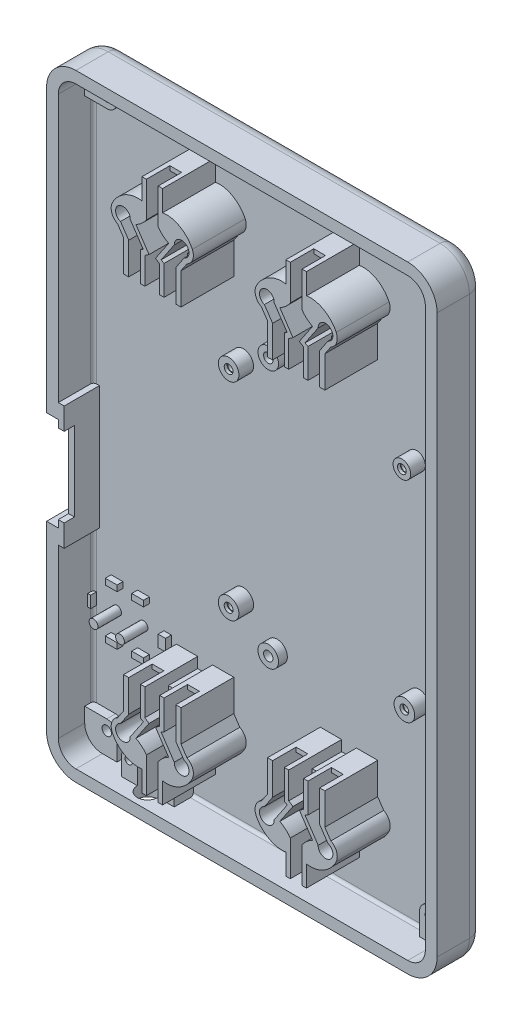
from build123d import *

# Parameters (mm, degrees)
SALIENTE_EXTRUIR1_DEPTH      = 16
REDONDEO1_R                  = 4.999999999999999
VACIADO1_T                   = -4
CORTAR_EXTRUIR5_DEPTH        = 153.71391475445148
CORTAR_EXTRUIR5_DEPTH_BACK   = 157.71391475445148
CORTAR_EXTRUIR5_START        = 4
CROQUIS4_R                   = 1.600000000000006
CORTAR_EXTRUIR6_START        = 3
CROQUIS4_19_R                = 3.5000000000000075
CROQUIS4_19_R_2              = 1.600000000000006
CORTAR_EXTRUIR6_DEPTH        = 3
SALIENTE_EXTRUIR14_START     = 7
CROQUIS4_21_R                = 3.5000000000000075
CROQUIS4_21_R_2              = 1.600000000000006
SALIENTE_EXTRUIR14_DEPTH     = 3
SALIENTE_EXTRUIR23_START     = 4
CROQUIS4_27_R                = 3.500000000000001
CROQUIS4_27_R_2              = 1.600000000000006
SALIENTE_EXTRUIR23_DEPTH     = 3
CROQUIS4_25_R                = 3.500000000000001
CROQUIS4_25_R_2              = 1.600000000000006
CORTAR_EXTRUIR23_DEPTH       = 3
CROQUIS4_24_R                = 1.600000000000006
CORTAR_EXTRUIR22_DEPTH       = 4
GUIA_START                   = 4
GUIA_CONTACTOS_DEPTH         = 18
ELEVADORES_START             = 4
CROQUIS5_23_W                = 3.999999999999968
CROQUIS5_23_H                = 1.495870233391173
CROQUIS5_23_W_2              = 3.999999999999927
CROQUIS5_23_H_2              = 1.5023941548379014
CROQUIS5_23_W_3              = 4.0000000000000036
CROQUIS5_23_H_3              = 1.50239415483788
CROQUIS5_23_H_4              = 1.5048196161779401
CROQUIS5_23_W_4              = 3.99999999999997
CROQUIS5_23_H_5              = 1.4958702333911873
CROQUIS5_23_W_5              = 4
CROQUIS5_23_H_6              = 1.5023941548378872
CROQUIS5_23_H_7              = 1.5023941548379156
CROQUIS5_23_W_6              = 3.999999999999993
CROQUIS5_23_W_7              = 4.000000000000014
CROQUIS5_23_W_8              = 3.9999999999999147
CROQUIS5_23_W_9              = 3.999999999999929
CROQUIS5_23_W_10             = 3.9999999999999716
ELEVADORES_DEPTH             = 10
SALIENTE_EXTRUIR16_START     = 4
CROQUIS5_28_R                = 1.4999999999999973
SALIENTE_EXTRUIR16_DEPTH     = 8.000000000000002
SALIENTE_EXTRUIR17_START     = 4
CROQUIS5_30_W                = 2.500000000000014
CROQUIS5_30_H                = 4.000000000000014
CROQUIS5_30_W_2              = 0.9999999999999716
CROQUIS5_30_H_2              = 4
CROQUIS5_30_W_3              = 3.999999999999986
CROQUIS5_30_H_3              = 2.0000000000000213
CROQUIS5_30_W_4              = 4
CROQUIS5_30_H_4              = 2.0000000000000284
SALIENTE_EXTRUIR17_DEPTH     = 2
CORTAR_EXTRUIR8_START        = 16
CROQUIS5_32_W                = 2.05583072877144
CROQUIS5_32_H                = 4.003270796249199
CORTAR_EXTRUIR8_DEPTH        = 9.2
SALIENTE_EXTRUIR19_START     = 4
SALIENTE_EXTRUIR19_DEPTH     = 12
SALIENTE_EXTRUIR20_START     = 4
CROQUIS5_34_W                = 2.0008606155560784
CROQUIS5_34_H                = 25.496729203750796
CROQUIS5_34_H_2              = 1.503270796249197
SALIENTE_EXTRUIR20_DEPTH     = 8.5
CORTAR_EXTRUIR7_START        = 4
CROQUIS5_26_R                = 1.2499999999999978
CORTAR_EXTRUIR7_DEPTH        = 1.5
SALIENTE_EXTRUIR15_START     = 4
SALIENTE_EXTRUIR15_OUTLINE_R = 1.25
SALIENTE_EXTRUIR15_DEPTH     = 6.5
CORTAR_EXTRUIR9_START        = -113.076923
CORTAR_EXTRUIR9_DEPTH        = 12.5
SALIENTE_EXTRUIR25_START     = 4
CROQUIS5_42_R                = 1.5000000000000009
CROQUIS5_42_R_2              = 3.500000000000001
CROQUIS5_42_R_3              = 1.5000000000000042
CROQUIS5_42_R_4              = 3.0000000000000004
CROQUIS5_42_R_5              = 1.4999999999999991
CROQUIS5_42_R_6              = 1.2499999999999978
CROQUIS5_42_R_7              = 1.2500000000000013
SALIENTE_EXTRUIR25_DEPTH     = 5
CORTAR_EXTRUIR24_START       = 8
CROQUIS5_44_R                = 1.5000000000000042
CROQUIS5_44_R_2              = 1.2499999999999978
CROQUIS5_44_R_3              = 1.5000000000000009
CROQUIS5_44_R_4              = 1.2500000000000013
CROQUIS5_44_R_5              = 1.4999999999999991
CORTAR_EXTRUIR24_DEPTH       = 1


# Read off the part's stored shape, not the designer's step: Saliente-Extruir15
with BuildPart() as part:
    # Croquis1 → Saliente-Extruir1 (new body)
    with BuildSketch(Plane.XY):
        with BuildLine():
            Line((-97.31663685152034, 96.9230769230769), (15.683363148479588, 96.92307692307689))
            ThreePointArc((15.683363148479588, 96.92307692307689), (22.75443096034506, 93.99414473494237), (25.683363148479593, 86.92307692307689))
            Line((25.683363148479593, 86.92307692307689), (25.68336314847961, -103.07692307692308))
            ThreePointArc((25.68336314847961, -103.07692307692308), (22.754430960345097, -110.14799088878856), (15.683363148479623, -113.07692307692308))
            Line((15.683363148479623, -113.07692307692308), (-97.31663685152034, -113.07692307692308))
            ThreePointArc((-97.31663685152034, -113.07692307692308), (-104.38770466338589, -110.14799088878856), (-107.31663685152041, -103.07692307692301))
            Line((-107.31663685152041, -103.07692307692301), (-107.31663685152041, 86.92307692307682))
            ThreePointArc((-107.31663685152041, 86.92307692307682), (-104.3877046633859, 93.99414473494238), (-97.31663685152034, 96.9230769230769))
        make_face()
    extrude(amount=SALIENTE_EXTRUIR1_DEPTH)

    # Redondeo1
    redondeo1_edges = [part.edges().sort_by_distance(p)[0] for p in [
        (-107.31663685152041, -8.076923076923094, 0),
        (-104.3877046633859, 93.99414473494238, 0),
        (-40.81663685152038, 96.9230769230769, 0),
        (22.75443096034506, 93.99414473494237, 0),
        (25.6833631484796, -8.076923076923094, 0),
        (22.754430960345097, -110.14799088878856, 0),
        (-40.816636851520364, -113.07692307692308, 0),
        (-104.38770466338589, -110.14799088878856, 0),
    ]]
    fillet(redondeo1_edges, radius=REDONDEO1_R)

    # Vaciado1
    vaciado1_openings = [part.faces().sort_by_distance(p)[0] for p in [
        (-40.816636852, -8.076923077, 16),
    ]]
    offset(amount=VACIADO1_T, openings=vaciado1_openings, kind=Kind.INTERSECTION)

    # Croquis4 → Cortar-Extruir5 (cut, two sides: drawn at the far end of the back side and taken through both)
    with BuildSketch(Plane.XY.offset(CORTAR_EXTRUIR5_START - CORTAR_EXTRUIR5_DEPTH_BACK)):
        with Locations(Location((-95.81663685152039, 85.4230769230769, 0), (0, 0, 180))):
            Circle(CROQUIS4_R)
        with Locations(Location((14.18336314847958, 85.4230769230769, 0), (0, 0, 180))):
            Circle(CROQUIS4_R)
        with Locations(Location((-95.81663685152039, -101.5769230769231, 0), (0, 0, 180))):
            Circle(CROQUIS4_R)
        with Locations(Location((14.18336314847958, -101.5769230769231, 0), (0, 0, 180))):
            Circle(CROQUIS4_R)
    extrude(amount=CORTAR_EXTRUIR5_DEPTH + CORTAR_EXTRUIR5_DEPTH_BACK, mode=Mode.SUBTRACT)

    # Croquis4<19> → Cortar-Extruir6 (cut)
    # profile 1 of 4: a face of its own
    with BuildSketch(Plane.XY.offset(CORTAR_EXTRUIR6_START)):
        with Locations(Location((-95.81663685152039, 85.4230769230769, 0), (0, 0, 180))):
            Circle(CROQUIS4_19_R)
        with Locations(Location((-95.81663685152039, 85.4230769230769, 0), (0, 0, 180))):
            Circle(CROQUIS4_19_R_2, mode=Mode.SUBTRACT)
    # profile 2 of 4: a face of its own
    with BuildSketch(Plane.XY.offset(CORTAR_EXTRUIR6_START)):
        with Locations(Location((14.18336314847958, 85.4230769230769, 0), (0, 0, 180))):
            Circle(CROQUIS4_19_R)
        with Locations(Location((14.18336314847958, 85.4230769230769, 0), (0, 0, 180))):
            Circle(CROQUIS4_19_R_2, mode=Mode.SUBTRACT)
    # profile 3 of 4: a face of its own
    with BuildSketch(Plane.XY.offset(CORTAR_EXTRUIR6_START)):
        with Locations(Location((-95.81663685152039, -101.5769230769231, 0), (0, 0, 180))):
            Circle(CROQUIS4_19_R)
        with Locations(Location((-95.81663685152039, -101.5769230769231, 0), (0, 0, 180))):
            Circle(CROQUIS4_19_R_2, mode=Mode.SUBTRACT)
    # profile 4 of 4: a face of its own
    with BuildSketch(Plane.XY.offset(CORTAR_EXTRUIR6_START)):
        with Locations(Location((14.18336314847958, -101.5769230769231, 0), (0, 0, 180))):
            Circle(CROQUIS4_19_R)
        with Locations(Location((14.18336314847958, -101.5769230769231, 0), (0, 0, 180))):
            Circle(CROQUIS4_19_R_2, mode=Mode.SUBTRACT)
    extrude(amount=-CORTAR_EXTRUIR6_DEPTH, mode=Mode.SUBTRACT)

    # Croquis4<21> → Saliente-Extruir14 (add)
    # profile 1 of 8: a face of its own
    with BuildSketch(Plane.XY.offset(SALIENTE_EXTRUIR14_START)):
        with BuildLine():
            Line((-92.31663685152039, -109.07692307692308), (-92.31663685152039, -101.5769230769231))
            ThreePointArc((-92.31663685152037, -101.5769230769231), (-98.29151058567331, -104.05179681107602), (-95.81663685152039, -98.07692307692308))
            Line((-95.81663685152039, -98.0769230769231), (-103.31663685152041, -98.0769230769231))
            ThreePointArc((-103.31663685152041, -98.0769230769231), (-101.66898680688021, -107.42927303228294), (-92.31663685152039, -109.0769230769231))
        make_face()
    # profile 2 of 8: a face of its own
    with BuildSketch(Plane.XY.offset(SALIENTE_EXTRUIR14_START)):
        with Locations(Location((-95.81663685152039, -101.5769230769231, 0), (0, 0, 180))):
            Circle(CROQUIS4_21_R)
        with Locations(Location((-95.81663685152039, -101.5769230769231, 0), (0, 0, 180))):
            Circle(CROQUIS4_21_R_2, mode=Mode.SUBTRACT)
    # profile 3 of 8: a face of its own
    with BuildSketch(Plane.XY.offset(SALIENTE_EXTRUIR14_START)):
        with Locations(Location((14.18336314847958, -101.5769230769231, 0), (0, 0, 180))):
            Circle(CROQUIS4_21_R)
        with Locations(Location((14.18336314847958, -101.5769230769231, 0), (0, 0, 180))):
            Circle(CROQUIS4_21_R_2, mode=Mode.SUBTRACT)
    # profile 4 of 8: a face of its own
    with BuildSketch(Plane.XY.offset(SALIENTE_EXTRUIR14_START)):
        with BuildLine():
            ThreePointArc((17.68336314847959, -101.5769230769231), (14.18336314847958, -105.07692307692311), (10.683363148479573, -101.5769230769231))
            Line((10.683363148479577, -101.5769230769231), (10.683363148479577, -109.0769230769231))
            ThreePointArc((10.683363148479579, -109.0769230769231), (20.03571310383939, -107.42927303228291), (21.683363148479582, -98.0769230769231))
            Line((21.683363148479586, -98.0769230769231), (14.18336314847958, -98.0769230769231))
            ThreePointArc((14.18336314847958, -98.07692307692308), (16.6582368826325, -99.10204934277017), (17.68336314847959, -101.5769230769231))
        make_face()
    # profile 5 of 8: a face of its own
    with BuildSketch(Plane.XY.offset(SALIENTE_EXTRUIR14_START)):
        with BuildLine():
            ThreePointArc((17.68336314847959, 85.4230769230769), (16.6582368826325, 82.94820318892398), (14.18336314847958, 81.92307692307689))
            Line((14.18336314847958, 81.9230769230769), (21.68336314847957, 81.9230769230769))
            ThreePointArc((21.68336314847958, 81.9230769230769), (20.03571310383939, 91.27542687843672), (10.683363148479579, 92.9230769230769))
            Line((10.683363148479577, 92.9230769230769), (10.683363148479577, 85.4230769230769))
            ThreePointArc((10.683363148479573, 85.4230769230769), (14.18336314847958, 88.92307692307692), (17.68336314847959, 85.4230769230769))
        make_face()
    # profile 6 of 8: a face of its own
    with BuildSketch(Plane.XY.offset(SALIENTE_EXTRUIR14_START)):
        with BuildLine():
            Line((-103.31663685152041, 81.9230769230769), (-95.81663685152039, 81.9230769230769))
            ThreePointArc((-95.81663685152039, 81.92307692307689), (-98.29151058567331, 87.89795065722983), (-92.31663685152037, 85.4230769230769))
            Line((-92.31663685152039, 85.4230769230769), (-92.31663685152039, 92.9230769230769))
            ThreePointArc((-92.31663685152039, 92.9230769230769), (-101.66898680688021, 91.27542687843673), (-103.31663685152041, 81.9230769230769))
        make_face()
    # profile 7 of 8: a face of its own
    with BuildSketch(Plane.XY.offset(SALIENTE_EXTRUIR14_START)):
        with Locations(Location((-95.81663685152039, 85.4230769230769, 0), (0, 0, 180))):
            Circle(CROQUIS4_21_R)
        with Locations(Location((-95.81663685152039, 85.4230769230769, 0), (0, 0, 180))):
            Circle(CROQUIS4_21_R_2, mode=Mode.SUBTRACT)
    # profile 8 of 8: a face of its own
    with BuildSketch(Plane.XY.offset(SALIENTE_EXTRUIR14_START)):
        with Locations(Location((14.18336314847958, 85.4230769230769, 0), (0, 0, 180))):
            Circle(CROQUIS4_21_R)
        with Locations(Location((14.18336314847958, 85.4230769230769, 0), (0, 0, 180))):
            Circle(CROQUIS4_21_R_2, mode=Mode.SUBTRACT)
    extrude(amount=-SALIENTE_EXTRUIR14_DEPTH)

    # Croquis4<27> → Saliente-Extruir23 (add)
    # profile 1 of 2: a face of its own
    with BuildSketch(Plane.XY.offset(SALIENTE_EXTRUIR23_START)):
        with Locations(Location((-40.81663685, -52.05517796000001, 0), (0, 0, 180))):
            Circle(CROQUIS4_27_R)
        with Locations(Location((-40.81663685, -52.05517796000001, 0), (0, 0, 180))):
            Circle(CROQUIS4_27_R_2, mode=Mode.SUBTRACT)
    # profile 2 of 2: a face of its own
    with BuildSketch(Plane.XY.offset(SALIENTE_EXTRUIR23_START)):
        with Locations(Location((-40.81663685, 35.90133180615383, 0), (0, 0, 180))):
            Circle(CROQUIS4_27_R)
        with Locations(Location((-40.81663685, 35.90133180615383, 0), (0, 0, 180))):
            Circle(CROQUIS4_27_R_2, mode=Mode.SUBTRACT)
    extrude(amount=SALIENTE_EXTRUIR23_DEPTH)

    # Croquis4<25> → Cortar-Extruir23 (cut)
    # profile 1 of 2: a face of its own
    with BuildSketch(Plane.XY):
        with Locations(Location((-40.81663685, 35.90133180615383, 0), (0, 0, 180))):
            Circle(CROQUIS4_25_R)
        with Locations(Location((-40.81663685, 35.90133180615383, 0), (0, 0, 180))):
            Circle(CROQUIS4_25_R_2, mode=Mode.SUBTRACT)
    # profile 2 of 2: a face of its own
    with BuildSketch(Plane.XY):
        with Locations(Location((-40.81663685, -52.05517796000001, 0), (0, 0, 180))):
            Circle(CROQUIS4_25_R)
    extrude(amount=CORTAR_EXTRUIR23_DEPTH, mode=Mode.SUBTRACT)

    # Croquis4<24> → Cortar-Extruir22 (cut)
    with BuildSketch(Plane.XY):
        with Locations(Location((-40.81663685, 35.90133180615383, 0), (0, 0, 180))):
            Circle(CROQUIS4_24_R)
        with Locations(Location((-40.81663685, 35.90133180615383, 0), (0, 0, 180))):
            Circle(CROQUIS4_24_R)
        with Locations(Location((-40.81663685, -52.05517796000001, 0), (0, 0, 180))):
            Circle(CROQUIS4_24_R)
        with Locations(Location((-40.81663685, -52.05517796000001, 0), (0, 0, 180))):
            Circle(CROQUIS4_24_R)
    extrude(amount=CORTAR_EXTRUIR22_DEPTH, mode=Mode.SUBTRACT)

    # Croquis5 → Guia contactos (add)
    with BuildSketch(Plane.XY.offset(GUIA_START)):
        with BuildLine():
            add(Edge.make_bspline(
                [(-14.31446443693543, 70.83330117078295), (-12.937333148817942, 68.81948124165703), (-10.732177002347047, 67.71401682524635)],
                knots=[0, 0, 0, 1, 1, 1], degree=2))
            Line((-10.732177002347047, 67.71401682524635), (-15.214799061629035, 61.06825632356019))
            Line((-15.214799061629035, 61.06825632356019), (-13.791142664068888, 60.10798795834564))
            Line((-13.791142664068888, 60.10798795834564), (-13.791142664068888, 51.01265147656485))
            Line((-13.791142664068888, 51.01265147656485), (-12.29114266406886, 51.01265147656485))
            Line((-12.29114266406886, 51.01265147656485), (-12.29114266406886, 61.012970877053235))
            Line((-12.29114266406886, 61.012970877053235), (-13.284871664701193, 61.57583078020071))
            Line((-13.284871664701193, 61.57583078020071), (-8.811328436935405, 68.20813136064118))
            ThreePointArc((-8.811328436935408, 68.20813136064118), (-4.916482478448227, 70.40589465712105), (-5.495178146715252, 65.97135974675818))
            Line((-5.4951781467152525, 65.97135974675818), (-8.29114266406894, 61.82617188398296))
            Line((-8.29114266406894, 61.82617188398296), (-8.29114266406893, 51.01265147656484))
            Line((-8.291142664068932, 51.01265147656485), (-6.540915292091843, 51.01265147656486))
            Line((-6.540915292091843, 51.01265147656486), (-6.540915292091857, 61.73855319674161))
            Line((-6.540915292091857, 61.73855319674161), (-4.495705334222554, 64.77070165269237))
            ThreePointArc((-4.495705334222555, 64.77070165269237), (-2.5392227122782574, 67.01135188264527), (-2.670528445962964, 69.98306797057487))
            add(Edge.make_bspline(
                [(-12.814464436935427, 75.67812155367763), (-8.642487954529075, 76.44626330917993), (-4.4067063051095925, 73.67631329568229), (-2.670528445962965, 69.98306797057487)],
                knots=[0, 0, 0, 0, 1, 1, 1, 1], degree=3))
            Line((-12.814464436935427, 75.67812155367763), (-12.814464436935427, 82.8335023695889))
            Line((-12.814464436935427, 82.8335023695889), (-14.31446443693543, 82.8335023695889))
            Line((-14.31446443693543, 82.8335023695889), (-14.31446443693543, 70.83330117078295))
        make_face()
        with BuildLine():
            Line((-17.414129812241907, 61.06825632356015), (-21.896751871523783, 67.71401682524635))
            add(Edge.make_bspline(
                [(-18.3144644369354, 70.83330117078295), (-19.691595725052892, 68.81948124165703), (-21.896751871523783, 67.71401682524635)],
                knots=[0, 0, 0, 1, 1, 1], degree=2))
            Line((-18.3144644369354, 70.83330117078295), (-18.3144644369354, 82.8335023695889))
            Line((-18.3144644369354, 82.8335023695889), (-19.814464436935403, 82.8335023695889))
            Line((-19.814464436935403, 82.8335023695889), (-19.814464436935403, 75.67812155367763))
            add(Edge.make_bspline(
                [(-19.814464436935403, 75.67812155367763), (-23.986440919341387, 76.44626330917968), (-28.22222256876174, 73.67631329568262), (-29.958400427907865, 69.98306797057487)],
                knots=[0, 0, 0, 0, 1, 1, 1, 1], degree=3))
            ThreePointArc((-29.958400427907865, 69.98306797057487), (-30.089706161592574, 67.01135188264529), (-28.133223539648306, 64.77070165269237))
            Line((-28.133223539648306, 64.77070165269237), (-26.088013581778974, 61.73855319674161))
            Line((-26.088013581778974, 61.73855319674161), (-26.088013581778974, 51.01265147656485))
            Line((-26.088013581778974, 51.01265147656485), (-24.337786209801976, 51.01265147656485))
            Line((-24.337786209801976, 51.01265147656485), (-24.337786209801976, 61.82617188398289))
            Line((-24.337786209801976, 61.82617188398289), (-27.133750727155558, 65.9713597467582))
            ThreePointArc((-27.133750727155558, 65.9713597467582), (-27.712446395422596, 70.40589465712107), (-23.817600436935415, 68.20813136064118))
            Line((-23.817600436935415, 68.20813136064118), (-19.344057209169673, 61.57583078020068))
            Line((-19.344057209169673, 61.57583078020068), (-20.337786209801973, 61.01297087705325))
            Line((-20.337786209801973, 61.01297087705325), (-20.337786209801973, 51.01265147656485))
            Line((-20.337786209801973, 51.01265147656485), (-18.83778620980197, 51.01265147656485))
            Line((-18.83778620980197, 51.01265147656485), (-18.837786209802054, 60.10798795834862))
            Line((-18.837786209802054, 60.10798795834862), (-17.414129812241907, 61.06825632356015))
        make_face()
        with BuildLine():
            Line((-21.89675187152377, -83.86786297909254), (-17.414129812241892, -77.22210247740634))
            Line((-17.414129812241892, -77.22210247740634), (-18.83778620980204, -76.2618341121948))
            Line((-18.83778620980204, -76.2618341121948), (-18.837786209801955, -67.16649763041104))
            Line((-18.837786209801955, -67.16649763041104), (-20.33778620980196, -67.16649763041104))
            Line((-20.33778620980196, -67.16649763041104), (-20.33778620980196, -77.16681703089944))
            Line((-20.33778620980196, -77.16681703089944), (-19.34405720916966, -77.72967693404686))
            Line((-19.34405720916966, -77.72967693404686), (-23.817600436935408, -84.36197751448736))
            ThreePointArc((-23.817600436935408, -84.36197751448736), (-27.712446395422603, -86.55974081096724), (-27.13375072715555, -82.12520590060436))
            Line((-27.13375072715555, -82.12520590060436), (-24.337786209801962, -77.98001803782907))
            Line((-24.337786209801962, -77.98001803782907), (-24.337786209801962, -67.16649763041104))
            Line((-24.337786209801962, -67.16649763041104), (-26.08801358177896, -67.16649763041104))
            Line((-26.08801358177896, -67.16649763041104), (-26.08801358177896, -77.8923993505878))
            Line((-26.08801358177896, -77.8923993505878), (-28.13322353964829, -80.92454780653856))
            ThreePointArc((-28.13322353964829, -80.92454780653856), (-30.08970616159256, -83.16519803649147), (-29.95840042790785, -86.13691412442105))
            add(Edge.make_bspline(
                [(-19.81446443693539, -91.83196770752382), (-23.986440919341433, -92.60010946302592), (-28.22222256876164, -89.83015944952878), (-29.95840042790785, -86.13691412442105)],
                knots=[0, 0, 0, 0, 1, 1, 1, 1], degree=3))
            Line((-19.81446443693539, -91.83196770752382), (-19.81446443693539, -98.98734852343509))
            Line((-19.81446443693539, -98.98734852343509), (-18.314464436935385, -98.98734852343509))
            Line((-18.314464436935385, -98.98734852343509), (-18.314464436935385, -86.98714732462913))
            add(Edge.make_bspline(
                [(-18.314464436935385, -86.98714732462913), (-19.691595725052878, -84.97332739550322), (-21.89675187152377, -83.86786297909254)],
                knots=[0, 0, 0, 1, 1, 1], degree=2))
        make_face()
        with BuildLine():
            Line((-15.214799061629021, -77.22210247740638), (-10.732177002347033, -83.86786297909254))
            add(Edge.make_bspline(
                [(-14.314464436935415, -86.98714732462913), (-12.937333148817928, -84.97332739550322), (-10.732177002347033, -83.86786297909254)],
                knots=[0, 0, 0, 1, 1, 1], degree=2))
            Line((-14.314464436935415, -86.98714732462913), (-14.314464436935415, -98.98734852343509))
            Line((-14.314464436935415, -98.98734852343509), (-12.814464436935415, -98.98734852343509))
            Line((-12.814464436935415, -98.98734852343509), (-12.814464436935415, -91.83196770752382))
            add(Edge.make_bspline(
                [(-12.814464436935415, -91.83196770752382), (-8.642487954529063, -92.60010946302613), (-4.406706305109576, -89.83015944952848), (-2.6705284459629506, -86.13691412442105)],
                knots=[0, 0, 0, 0, 1, 1, 1, 1], degree=3))
            ThreePointArc((-2.6705284459629506, -86.13691412442105), (-2.539222712278244, -83.16519803649146), (-4.49570533422254, -80.92454780653856))
            Line((-4.4957053342225395, -80.92454780653856), (-6.540915292091843, -77.8923993505878))
            Line((-6.540915292091843, -77.8923993505878), (-6.54091529209183, -67.16649763041104))
            Line((-6.54091529209183, -67.16649763041104), (-8.291142664068918, -67.16649763041104))
            Line((-8.291142664068916, -67.16649763041106), (-8.291142664068925, -77.98001803782914))
            Line((-8.291142664068925, -77.98001803782914), (-5.495178146715238, -82.12520590060436))
            ThreePointArc((-5.4951781467152365, -82.12520590060436), (-4.9164824784481915, -86.55974081096723), (-8.811328436935389, -84.36197751448736))
            Line((-8.811328436935389, -84.36197751448736), (-13.284871664701178, -77.72967693404689))
            Line((-13.284871664701178, -77.72967693404689), (-12.291142664068845, -77.16681703089942))
            Line((-12.291142664068845, -77.16681703089942), (-12.291142664068845, -67.16649763041104))
            Line((-12.291142664068845, -67.16649763041104), (-13.791142664068873, -67.16649763041104))
            Line((-13.791142664068873, -67.16649763041104), (-13.791142664068873, -76.26183411219182))
            Line((-13.791142664068873, -76.26183411219182), (-15.214799061629021, -77.22210247740638))
        make_face()
        with BuildLine():
            Line((-59.73480060040493, 67.71401682524635), (-64.2174226596868, 61.06825632356015))
            Line((-64.2174226596868, 61.06825632356015), (-62.79376626212665, 60.10798795834862))
            Line((-62.79376626212665, 60.10798795834862), (-62.79376626212674, 51.01265147656485))
            Line((-62.79376626212674, 51.01265147656485), (-61.293766262126745, 51.01265147656485))
            Line((-61.293766262126745, 51.01265147656485), (-61.293766262126745, 61.01297087705325))
            Line((-61.293766262126745, 61.01297087705325), (-62.287495262759045, 61.57583078020068))
            Line((-62.287495262759045, 61.57583078020068), (-57.81395203499329, 68.20813136064118))
            ThreePointArc((-57.8139520349933, 68.20813136064118), (-53.91910607650611, 70.40589465712107), (-54.49780174477315, 65.9713597467582))
            Line((-54.49780174477315, 65.9713597467582), (-57.29376626212674, 61.82617188398289))
            Line((-57.29376626212674, 61.82617188398289), (-57.29376626212674, 51.01265147656485))
            Line((-57.29376626212674, 51.01265147656485), (-55.54353889014974, 51.01265147656485))
            Line((-55.54353889014974, 51.01265147656485), (-55.54353889014974, 61.73855319674161))
            Line((-55.54353889014974, 61.73855319674161), (-53.49832893228041, 64.77070165269237))
            ThreePointArc((-53.49832893228041, 64.77070165269237), (-51.54184631033615, 67.01135188264529), (-51.67315204402085, 69.98306797057487))
            add(Edge.make_bspline(
                [(-61.81708803499331, 75.67812155367763), (-57.64511155258735, 76.44626330917976), (-53.40932990316697, 73.67631329568256), (-51.67315204402085, 69.98306797057487)],
                knots=[0, 0, 0, 0, 1, 1, 1, 1], degree=3))
            Line((-61.81708803499331, 75.67812155367763), (-61.81708803499331, 82.8335023695889))
            Line((-61.81708803499331, 82.8335023695889), (-63.317088034993304, 82.8335023695889))
            Line((-63.317088034993304, 82.8335023695889), (-63.317088034993304, 70.83330117078295))
            add(Edge.make_bspline(
                [(-63.317088034993304, 70.83330117078295), (-61.93995674687582, 68.81948124165704), (-59.73480060040493, 67.71401682524635)],
                knots=[0, 0, 0, 1, 1, 1], degree=2))
        make_face()
        with BuildLine():
            Line((-66.41675341029968, 61.06825632356019), (-70.89937546958167, 67.71401682524635))
            add(Edge.make_bspline(
                [(-67.31708803499329, 70.83330117078295), (-68.69421932311076, 68.81948124165703), (-70.89937546958167, 67.71401682524635)],
                knots=[0, 0, 0, 1, 1, 1], degree=2))
            Line((-67.31708803499329, 70.83330117078295), (-67.31708803499329, 82.8335023695889))
            Line((-67.31708803499329, 82.8335023695889), (-68.81708803499329, 82.8335023695889))
            Line((-68.81708803499329, 82.8335023695889), (-68.81708803499329, 75.67812155367763))
            add(Edge.make_bspline(
                [(-68.81708803499329, 75.67812155367763), (-72.98906451739963, 76.44626330917993), (-77.22484616681912, 73.67631329568229), (-78.96102402596574, 69.98306797057487)],
                knots=[0, 0, 0, 0, 1, 1, 1, 1], degree=3))
            ThreePointArc((-78.96102402596574, 69.98306797057487), (-79.09232975965044, 67.01135188264527), (-77.13584713770616, 64.77070165269237))
            Line((-77.13584713770616, 64.77070165269237), (-75.09063717983686, 61.73855319674161))
            Line((-75.09063717983686, 61.73855319674161), (-75.09063717983688, 51.01265147656486))
            Line((-75.09063717983688, 51.01265147656486), (-73.34040980785977, 51.01265147656485))
            Line((-73.34040980785977, 51.01265147656485), (-73.34040980785977, 61.82617188398296))
            Line((-73.34040980785977, 61.82617188398296), (-76.13637432521347, 65.97135974675818))
            ThreePointArc((-76.13637432521347, 65.97135974675818), (-76.71506999348048, 70.40589465712105), (-72.8202240349933, 68.20813136064118))
            Line((-72.8202240349933, 68.20813136064118), (-68.34668080722751, 61.57583078020071))
            Line((-68.34668080722751, 61.57583078020071), (-69.34040980785986, 61.012970877053235))
            Line((-69.34040980785986, 61.012970877053235), (-69.34040980785986, 51.01265147656485))
            Line((-69.34040980785986, 51.01265147656485), (-67.84040980785983, 51.01265147656485))
            Line((-67.84040980785983, 51.01265147656485), (-67.84040980785983, 60.10798795834564))
            Line((-67.84040980785983, 60.10798795834564), (-66.41675341029968, 61.06825632356019))
        make_face()
        with BuildLine():
            Line((-62.79245446309785, -67.15838464858895), (-62.79245446309785, -76.25372113036973))
            Line((-62.79245446309785, -76.25372113036973), (-64.21611086065799, -77.21398949558427))
            Line((-64.21611086065799, -77.21398949558427), (-59.733488801376005, -83.85974999727043))
            add(Edge.make_bspline(
                [(-63.31577623596439, -86.97903434280703), (-61.93864494784689, -84.96521441368111), (-59.733488801376005, -83.85974999727043)],
                knots=[0, 0, 0, 1, 1, 1], degree=2))
            Line((-63.31577623596439, -86.97903434280703), (-63.31577623596439, -98.979235541613))
            Line((-63.31577623596439, -98.979235541613), (-61.81577623596439, -98.979235541613))
            Line((-61.81577623596439, -98.979235541613), (-61.81577623596439, -91.82385472570172))
            add(Edge.make_bspline(
                [(-61.81577623596439, -91.82385472570172), (-57.64379975355801, -92.591996481204), (-53.40801810413858, -89.8220464677064), (-51.67184024499193, -86.12880114259895)],
                knots=[0, 0, 0, 0, 1, 1, 1, 1], degree=3))
            ThreePointArc((-51.67184024499193, -86.12880114259895), (-51.54053451130722, -83.15708505466935), (-53.49701713325152, -80.91643482471646))
            Line((-53.49701713325152, -80.91643482471646), (-55.54222709112082, -77.8842863687657))
            Line((-55.54222709112082, -77.8842863687657), (-55.54222709112081, -67.15838464858895))
            Line((-55.54222709112081, -67.15838464858895), (-57.29245446309789, -67.15838464858895))
            Line((-57.29245446309789, -67.15838464858895), (-57.2924544630979, -77.97190505600705))
            Line((-57.2924544630979, -77.97190505600705), (-54.496489945744216, -82.11709291878228))
            ThreePointArc((-54.496489945744216, -82.11709291878228), (-53.91779427747719, -86.55162782914515), (-57.81264023596437, -84.35386453266526))
            Line((-57.812640235964366, -84.35386453266526), (-62.286183463730154, -77.7215639522248))
            Line((-62.286183463730154, -77.7215639522248), (-61.29245446309782, -77.15870404907731))
            Line((-61.29245446309782, -77.15870404907731), (-61.29245446309782, -67.15838464858895))
            Line((-61.29245446309782, -67.15838464858895), (-62.79245446309785, -67.15838464858895))
        make_face()
        with BuildLine():
            Line((-67.83909800883102, -76.25372113037271), (-67.83909800883093, -67.15838464858895))
            Line((-67.83909800883093, -67.15838464858895), (-69.33909800883094, -67.15838464858895))
            Line((-69.33909800883094, -67.15838464858895), (-69.33909800883094, -77.15870404907733))
            Line((-69.33909800883094, -77.15870404907733), (-68.34536900819865, -77.72156395222477))
            Line((-68.34536900819865, -77.72156395222477), (-72.81891223596438, -84.35386453266526))
            ThreePointArc((-72.81891223596438, -84.35386453266526), (-76.71375819445156, -86.55162782914515), (-76.13506252618453, -82.11709291878228))
            Line((-76.13506252618453, -82.11709291878228), (-73.33909800883094, -77.97190505600697))
            Line((-73.33909800883094, -77.97190505600697), (-73.33909800883094, -67.15838464858895))
            Line((-73.33909800883094, -67.15838464858895), (-75.08932538080794, -67.15838464858895))
            Line((-75.08932538080794, -67.15838464858895), (-75.08932538080794, -77.8842863687657))
            Line((-75.08932538080794, -77.8842863687657), (-77.13453533867727, -80.91643482471646))
            ThreePointArc((-77.13453533867727, -80.91643482471646), (-79.09101796062154, -83.15708505466937), (-78.95971222693683, -86.12880114259895))
            add(Edge.make_bspline(
                [(-68.81577623596436, -91.82385472570172), (-72.9877527183704, -92.59199648120395), (-77.22353436779065, -89.82204646770649), (-78.95971222693683, -86.12880114259895)],
                knots=[0, 0, 0, 0, 1, 1, 1, 1], degree=3))
            Line((-68.81577623596436, -91.82385472570172), (-68.81577623596436, -98.979235541613))
            Line((-68.81577623596436, -98.979235541613), (-67.31577623596436, -98.979235541613))
            Line((-67.31577623596436, -98.979235541613), (-67.31577623596436, -86.97903434280703))
            add(Edge.make_bspline(
                [(-67.31577623596436, -86.97903434280703), (-68.69290752408186, -84.96521441368112), (-70.89806367055274, -83.85974999727043)],
                knots=[0, 0, 0, 1, 1, 1], degree=2))
            Line((-70.89806367055274, -83.85974999727043), (-66.41544161127088, -77.21398949558424))
            Line((-66.41544161127088, -77.21398949558424), (-67.83909800883102, -76.25372113037271))
        make_face()
    extrude(amount=GUIA_CONTACTOS_DEPTH)

    # Croquis5<23> → Elevadores (add)
    with BuildSketch(Plane.XY.offset(ELEVADORES_START)):
        Polygon((-12.134895390041894, 65.6344012938347), (-11.123561495760207, 67.13376545163082), (-21.50536737811063, 67.13376545163082), (-20.49403348382897, 65.63440129383469), align=None)
        with Locations((-16.314464436935417, 82.08556725289331)):
            Rectangle(CROQUIS5_23_W, CROQUIS5_23_H)
        Polygon((-13.791142664068804, 54.6136300416902), (-13.791142664068833, 56.11249095564365), (-18.837786209802026, 56.11249095564365), (-18.837786209802005, 54.6136300416902), align=None)
        with Locations((-10.291142664068897, 51.763848553983806)):
            Rectangle(CROQUIS5_23_W_2, CROQUIS5_23_H_2)
        with Locations((-22.337786209801976, 51.76384855398379)):
            Rectangle(CROQUIS5_23_W_3, CROQUIS5_23_H_3)
        Polygon((-12.29114266406886, 60.10798795834865), (-12.29114266406886, 58.603168342170605), (-8.291142664068882, 58.603168342170605), (-8.291142664068937, 60.107987958348666), align=None)
        with Locations((-22.337786209801976, 59.355578150259575)):
            Rectangle(CROQUIS5_23_W_3, CROQUIS5_23_H_4)
        with BuildLine():
            Line((-9.535997392767996, 67.13376545163082), (-10.547331287049696, 65.6344012938347))
            Line((-10.547331287049701, 65.6344012938347), (-5.722459493034173, 65.6344012938347))
            Line((-5.722459493034181, 65.6344012938347), (-5.4951781467152525, 65.97135974675818))
            ThreePointArc((-5.495178146715252, 65.97135974675818), (-4.699873638055999, 66.42461212642796), (-4.1210398600819005, 67.13376545163082))
            Line((-4.1210398600818925, 67.13376545163082), (-9.535997392767994, 67.13376545163082))
        make_face()
        with BuildLine():
            Line((-27.13375072715556, 65.97135974675818), (-26.906469380836644, 65.6344012938347))
            Line((-26.90646938083665, 65.6344012938347), (-22.08159758682115, 65.6344012938347))
            Line((-22.08159758682115, 65.6344012938347), (-23.092931481102838, 67.13376545163082))
            Line((-23.09293148110284, 67.13376545163082), (-28.50788901378893, 67.13376545163082))
            ThreePointArc((-28.50788901378892, 67.13376545163084), (-27.929055235814815, 66.42461212642796), (-27.133750727155558, 65.9713597467582))
        make_face()
        Polygon((-20.494033483828957, -81.78824744768087), (-21.50536737811062, -83.28761160547701), (-11.123561495760192, -83.28761160547701), (-12.13489539004188, -81.78824744768089), align=None)
        with Locations((-16.3144644369354, -98.23941340673952)):
            Rectangle(CROQUIS5_23_W_4, CROQUIS5_23_H_5)
        Polygon((-18.837786209801997, -70.76747619553639), (-18.83778620980201, -72.26633710948984), (-13.791142664068818, -72.26633710948984), (-13.791142664068873, -70.76747619553639), align=None)
        with Locations((-22.33778620980196, -67.91769470782998)):
            Rectangle(CROQUIS5_23_W_5, CROQUIS5_23_H_6)
        with Locations((-10.291142664068882, -67.91769470783001)):
            Rectangle(CROQUIS5_23_W_2, CROQUIS5_23_H_7)
        with Locations((-22.33778620980196, -75.50942430410576)):
            Rectangle(CROQUIS5_23_W_5, CROQUIS5_23_H_4)
        Polygon((-8.291142664068868, -74.7570144960168), (-12.291142664068872, -74.7570144960168), (-12.291142664068838, -76.26183411219483), (-8.291142664068868, -76.26183411219485), align=None)
        with BuildLine():
            Line((-23.092931481102827, -83.28761160547701), (-22.081597586821136, -81.78824744768089))
            Line((-22.081597586821136, -81.78824744768089), (-26.906469380836636, -81.78824744768089))
            Line((-26.90646938083664, -81.78824744768089), (-27.13375072715555, -82.12520590060436))
            ThreePointArc((-27.13375072715555, -82.12520590060436), (-27.929055235814815, -82.57845828027413), (-28.50788901378892, -83.28761160547701))
            Line((-28.507889013788915, -83.28761160547701), (-23.092931481102827, -83.28761160547701))
        make_face()
        with BuildLine():
            Line((-5.495178146715239, -82.12520590060436), (-5.722459493034162, -81.78824744768089))
            Line((-5.72245949303416, -81.78824744768089), (-10.547331287049689, -81.78824744768089))
            Line((-10.54733128704968, -81.78824744768089), (-9.535997392767982, -83.28761160547701))
            Line((-9.53599739276798, -83.28761160547701), (-4.121039860081879, -83.28761160547701))
            ThreePointArc((-4.12103986008187, -83.28761160547701), (-4.6998736380559745, -82.57845828027413), (-5.4951781467152365, -82.12520590060436))
        make_face()
        Polygon((-61.13751898809974, 65.63440129383469), (-60.12618509381808, 67.13376545163082), (-70.5079909761685, 67.13376545163082), (-69.49665708188682, 65.63440129383469), align=None)
        with Locations((-65.31708803499329, 82.08556725289331)):
            Rectangle(CROQUIS5_23_W_6, CROQUIS5_23_H)
        Polygon((-62.79376626212671, 54.6136300416902), (-62.79376626212668, 56.11249095564365), (-67.84040980785988, 56.11249095564365), (-67.84040980785983, 54.6136300416902), align=None)
        with Locations((-59.293766262126745, 51.76384855398379)):
            Rectangle(CROQUIS5_23_W_7, CROQUIS5_23_H_3)
        with Locations((-71.34040980785981, 51.763848553983806)):
            Rectangle(CROQUIS5_23_W_8, CROQUIS5_23_H_2)
        with Locations((-59.293766262126745, 59.355578150259575)):
            Rectangle(CROQUIS5_23_W_7, CROQUIS5_23_H_4)
        Polygon((-73.34040980785983, 58.603168342170605), (-69.34040980785983, 58.603168342170605), (-69.34040980785986, 60.10798795834865), (-73.34040980785983, 60.107987958348666), align=None)
        with BuildLine():
            Line((-58.53862099082587, 67.13376545163082), (-59.54995488510757, 65.6344012938347))
            Line((-59.54995488510757, 65.6344012938347), (-54.72508309109207, 65.6344012938347))
            Line((-54.72508309109207, 65.6344012938347), (-54.49780174477315, 65.97135974675818))
            ThreePointArc((-54.49780174477315, 65.9713597467582), (-53.7024972361139, 66.42461212642796), (-53.123663458139795, 67.13376545163082))
            Line((-53.12366345813979, 67.13376545163082), (-58.53862099082587, 67.13376545163082))
        make_face()
        with BuildLine():
            Line((-76.13637432521347, 65.97135974675818), (-75.90909297889453, 65.6344012938347))
            Line((-75.90909297889453, 65.6344012938347), (-71.084221184879, 65.6344012938347))
            Line((-71.08422118487901, 65.63440129383469), (-72.0955550791607, 67.13376545163082))
            Line((-72.09555507916072, 67.13376545163082), (-77.5105126118468, 67.13376545163082))
            ThreePointArc((-77.5105126118468, 67.13376545163082), (-76.93167883387271, 66.42461212642796), (-76.13637432521347, 65.97135974675818))
        make_face()
        Polygon((-67.83909800883099, -72.25822412766773), (-62.79245446309779, -72.25822412766773), (-62.79245446309777, -70.7593632137143), (-67.83909800883097, -70.7593632137143), align=None)
        with Locations((-59.292454463097855, -67.9095817260079)):
            Rectangle(CROQUIS5_23_W_9, CROQUIS5_23_H_7)
        Polygon((-60.12487329478916, -83.27949862365492), (-61.13620718907085, -81.78013446585878), (-69.49534528285793, -81.78013446585878), (-70.5066791771396, -83.27949862365492), align=None)
        with Locations((-71.33909800883094, -67.9095817260079)):
            Rectangle(CROQUIS5_23_W_5, CROQUIS5_23_H_6)
        Polygon((-57.29245446309785, -74.7489015141947), (-61.29245446309785, -74.7489015141947), (-61.29245446309781, -76.25372113037274), (-57.29245446309785, -76.25372113037275), align=None)
        with Locations((-71.33909800883094, -75.50131132228367)):
            Rectangle(CROQUIS5_23_W_5, CROQUIS5_23_H_4)
        with Locations((-65.31577623596438, -98.2313004249174)):
            Rectangle(CROQUIS5_23_W_10, CROQUIS5_23_H_5)
        with BuildLine():
            Line((-54.496489945744216, -82.11709291878226), (-54.72377129206314, -81.7801344658588))
            Line((-54.723771292063134, -81.78013446585878), (-59.54864308607866, -81.78013446585878))
            Line((-59.548643086078656, -81.78013446585878), (-58.53730919179695, -83.27949862365492))
            Line((-58.53730919179696, -83.27949862365492), (-53.122351659110855, -83.27949862365492))
            ThreePointArc((-53.12235165911086, -83.27949862365492), (-53.701185437084966, -82.57034529845205), (-54.49648994574422, -82.11709291878228))
        make_face()
        with BuildLine():
            Line((-71.08290938585012, -81.78013446585878), (-75.90778117986562, -81.78013446585878))
            Line((-75.90778117986561, -81.7801344658588), (-76.13506252618453, -82.11709291878226))
            ThreePointArc((-76.13506252618453, -82.11709291878228), (-76.93036703484378, -82.57034529845205), (-77.5092008128179, -83.27949862365492))
            Line((-77.5092008128179, -83.27949862365492), (-72.0942432801318, -83.27949862365492))
            Line((-72.0942432801318, -83.27949862365492), (-71.08290938585012, -81.78013446585878))
        make_face()
    extrude(amount=ELEVADORES_DEPTH)

    # Croquis5<28> → Saliente-Extruir16 (add)
    with BuildSketch(Plane.XY.offset(SALIENTE_EXTRUIR16_START)):
        with Locations(Location((-95.3166368515204, -67.3410885494072, 0), (0, 0, 180))):
            Circle(CROQUIS5_28_R)
        with Locations(Location((-86.31663685152041, -67.3410885494072, 0), (0, 0, 180))):
            Circle(CROQUIS5_28_R)
    extrude(amount=SALIENTE_EXTRUIR16_DEPTH)

    # Croquis5<30> → Saliente-Extruir17 (add)
    with BuildSketch(Plane.XY.offset(SALIENTE_EXTRUIR17_START)):
        with Locations((-78.0666368515204, -67.3410885494072)):
            Rectangle(CROQUIS5_30_W, CROQUIS5_30_H)
        Polygon((-84.3166368515204, -76.84108854940715), (-84.31663685152041, -74.84108854940719), (-88.31663685152041, -74.84108854940719), (-88.31663685152041, -76.84108854940715), align=None)
        Polygon((-93.3166368515204, -76.84108854940716), (-93.31663685152041, -74.84108854940719), (-97.3166368515204, -74.84108854940719), (-97.3166368515204, -76.84108854940716), align=None)
        with Locations((-102.81663685152039, -67.3410885494072)):
            Rectangle(CROQUIS5_30_W_2, CROQUIS5_30_H_2)
        with Locations((-95.3166368515204, -58.84108854940716)):
            Rectangle(CROQUIS5_30_W_3, CROQUIS5_30_H_3)
        with Locations((-86.31663685152041, -58.84108854940716)):
            Rectangle(CROQUIS5_30_W_4, CROQUIS5_30_H_4)
    extrude(amount=SALIENTE_EXTRUIR17_DEPTH)

    # Croquis5<32> → Cortar-Extruir8 (cut)
    with BuildSketch(Plane.XY.offset(CORTAR_EXTRUIR8_START)):
        Polygon((-105.31577623596436, -9.043388457301907), (-107.31577623596438, -9.043388457301907), (-107.31577623596439, -13.046659253551098), (-105.31577623596438, -13.046659253551105), align=None)
        Polygon((-105.31577623596438, -13.046659253551105), (-107.31577623596438, -13.046659253551105), (-107.31577623596439, -41.0433884573019), (-105.31577623596436, -41.0433884573019), align=None)
        Polygon((-103.31663685152041, -13.046659253551105), (-105.31577623596438, -13.046659253551105), (-105.31577623596436, -41.0433884573019), (-103.31663685152041, -41.0433884573019), (-103.31663685152041, -38.5433884573019), align=None)
        Polygon((-107.31577623596439, -41.0433884573019), (-107.31577623596439, -13.046659253551098), (-107.3716069647358, -13.046659253551105), (-107.3716069647358, -41.0433884573019), align=None)
        Polygon((-103.31663685152041, -9.043388457301907), (-105.31577623596436, -9.043388457301907), (-105.31577623596436, -13.046659253551105), (-103.31663685152041, -13.046659253551105), (-103.31663685152041, -11.543388457301909), align=None)
        with Locations((-106.34369160035008, -11.045023855426507)):
            Rectangle(CROQUIS5_32_W, CROQUIS5_32_H)
    extrude(amount=-CORTAR_EXTRUIR8_DEPTH, mode=Mode.SUBTRACT)

    # Croquis5<33> → Saliente-Extruir19 (add)
    with BuildSketch(Plane.XY.offset(SALIENTE_EXTRUIR19_START)):
        Polygon((-103.31663685152041, -4.043388457301914), (-103.31663685152041, -11.543388457301909), (-101.31577623596435, -11.54338845730191), (-101.31577623596436, -4.043388457301908), align=None)
        Polygon((-103.31663685152041, -38.5433884573019), (-103.31663685152041, -46.04338845730191), (-101.31577623596434, -46.0433884573019), (-101.31577623596435, -38.5433884573019), align=None)
    extrude(amount=SALIENTE_EXTRUIR19_DEPTH)

    # Croquis5<34> → Saliente-Extruir20 (add)
    with BuildSketch(Plane.XY.offset(SALIENTE_EXTRUIR20_START)):
        with Locations((-102.31620654374237, -25.795023855426503)):
            Rectangle(CROQUIS5_34_W, CROQUIS5_34_H)
        with Locations((-102.31620654374237, -12.295023855426507)):
            Rectangle(CROQUIS5_34_W, CROQUIS5_34_H_2)
    extrude(amount=SALIENTE_EXTRUIR20_DEPTH)

    # Croquis5<26> → Cortar-Extruir7 (cut)
    with BuildSketch(Plane.XY.offset(CORTAR_EXTRUIR7_START)):
        with Locations(Location((-84.84383385259015, -103.07692307692307, 0), (0, 0, 180))):
            Circle(CROQUIS5_26_R)
        with Locations(Location((-71.84395161601014, -103.07692307692307, 0), (0, 0, 180))):
            Circle(CROQUIS5_26_R)
    extrude(amount=-CORTAR_EXTRUIR7_DEPTH, mode=Mode.SUBTRACT)

    # Saliente-Extruir15 outline → Saliente-Extruir15 (add)
    with BuildSketch(Plane.XY.offset(SALIENTE_EXTRUIR15_START)):
        with BuildLine():
            Line((-87.343833853, -103.076923077), (-87.343833853, -109.076923077))
            Line((-87.343833853, -109.076923077), (-69.343951616, -109.076923077))
            Line((-69.343951616, -109.076923077), (-69.343951616, -103.076923077))
            ThreePointArc((-69.343951616, -103.076923077), (-70.076184663, -101.309156124), (-71.843951616, -100.576923077))
            Line((-71.843951616, -100.576923077), (-84.843833853, -100.576923077))
            ThreePointArc((-84.843833853, -100.576923077), (-86.611600806, -101.309156124), (-87.343833853, -103.076923077))
        make_face()
        with Locations((-84.843833853, -103.076923077)):
            Circle(SALIENTE_EXTRUIR15_OUTLINE_R, mode=Mode.SUBTRACT)
        with Locations((-71.843951616, -103.076923077)):
            Circle(SALIENTE_EXTRUIR15_OUTLINE_R, mode=Mode.SUBTRACT)
    extrude(amount=SALIENTE_EXTRUIR15_DEPTH)

    # Croquis6 → Cortar-Extruir9 (cut)
    with BuildSketch(Plane(origin=(0, 0, 0), x_dir=(1, 0, 0), z_dir=(0, 1, 0)).offset(CORTAR_EXTRUIR9_START)):
        with BuildLine():
            ThreePointArc((-81.91018178152041, -10.5), (-78.41018178152041, -14.000000000000007), (-74.91018178152041, -10.5))
            Line((-74.91018178152041, -10.5), (-78.41018178152041, -10.5))
            Line((-78.41018178152041, -10.5), (-81.91018178152041, -10.5))
        make_face()
        with BuildLine():
            Line((-78.41018178152041, -10.5), (-74.91018178152041, -10.5))
            ThreePointArc((-74.91018178152041, -10.5), (-75.93530804736749, -8.025126265847078), (-78.41018178152041, -6.999999999999993))
            Line((-78.41018178152041, -6.999999999999993), (-78.41018178152041, -10.5))
        make_face()
        with BuildLine():
            ThreePointArc((-78.41018178152041, -6.999999999999993), (-80.88505551567333, -8.025126265847078), (-81.91018178152041, -10.5))
            Line((-81.91018178152041, -10.5), (-78.41018178152041, -10.5))
            Line((-78.41018178152041, -10.5), (-78.41018178152041, -6.999999999999993))
        make_face()
        with BuildLine():
            ThreePointArc((-78.41018178152041, -6.999999999999993), (-80.88505551567333, -8.025126265847078), (-81.91018178152041, -10.5))
            Line((-81.91018178152041, -10.5), (-78.41018178152041, -10.5))
            Line((-78.41018178152041, -10.5), (-78.41018178152041, -6.999999999999993))
        make_face()
    extrude(amount=CORTAR_EXTRUIR9_DEPTH, mode=Mode.SUBTRACT)

    # Croquis5<42> → Saliente-Extruir25 (add)
    # profile 1 of 9: a face of its own
    with BuildSketch(Plane.XY.offset(SALIENTE_EXTRUIR25_START)):
        with BuildLine():
            Line((10.683363148479595, -43.35672368244451), (10.683363148479595, -41.131109052205176))
            ThreePointArc((10.683363148479568, -41.13110905220518), (4.033363148479596, -42.65672368244442), (10.683363148479499, -44.18233831268396))
            Line((10.683363148479595, -44.18233831268398), (10.683363148479595, -43.35672368244451))
        make_face()
        with Locations((7.5333631484796015, -42.6567236824445)):
            Circle(CROQUIS5_42_R, mode=Mode.SUBTRACT)
    # profile 2 of 9: a face of its own
    with BuildSketch(Plane.XY.offset(SALIENTE_EXTRUIR25_START)):
        with BuildLine():
            ThreePointArc((11.033363148479607, -42.6567236824445), (10.944741169162734, -41.87409989031953), (10.683363148479568, -41.13110905220518))
            Line((10.683363148479595, -41.131109052205176), (10.683363148479595, -43.35672368244451))
            Line((10.683363148479595, -43.35672368244451), (10.683363148479595, -44.18233831268398))
            ThreePointArc((10.683363148479499, -44.18233831268396), (10.944741169162718, -43.439347474569544), (11.033363148479607, -42.6567236824445))
        make_face()
    # profile 3 of 9: a face of its own
    with BuildSketch(Plane.XY.offset(SALIENTE_EXTRUIR25_START)):
        with Locations(Location((-52.31663685152041, -42.556723682444506, 0), (0, 0, 180))):
            Circle(CROQUIS5_42_R_2)
        with Locations((-52.31663685152041, -42.556723682444506)):
            Circle(CROQUIS5_42_R_3, mode=Mode.SUBTRACT)
    # profile 4 of 9: a face of its own
    with BuildSketch(Plane.XY.offset(SALIENTE_EXTRUIR25_START)):
        with Locations(Location((-52.31663685152041, 27.843276317555496, 0), (0, 0, 180))):
            Circle(CROQUIS5_42_R_2)
        with Locations((-52.31663685152041, 27.843276317555496)):
            Circle(CROQUIS5_42_R_3, mode=Mode.SUBTRACT)
    # profile 5 of 9: a face of its own
    with BuildSketch(Plane.XY.offset(SALIENTE_EXTRUIR25_START)):
        with Locations(Location((6.683363148479593, 27.843276317555496, 0), (0, 0, 180))):
            Circle(CROQUIS5_42_R_4)
        with Locations((6.683363148479593, 27.843276317555496)):
            Circle(CROQUIS5_42_R_5, mode=Mode.SUBTRACT)
    # profile 6 of 9: a face of its own
    with BuildSketch(Plane.XY.offset(SALIENTE_EXTRUIR25_START)):
        with Locations((-52.31663685152041, -42.556723682444506)):
            Circle(CROQUIS5_42_R_3)
        with Locations(Location((-52.31663685152041, -42.556723682444506, 0), (0, 0, 180))):
            Circle(CROQUIS5_42_R_6, mode=Mode.SUBTRACT)
    # profile 7 of 9: a face of its own
    with BuildSketch(Plane.XY.offset(SALIENTE_EXTRUIR25_START)):
        with Locations((7.5333631484796015, -42.6567236824445)):
            Circle(CROQUIS5_42_R)
        with Locations(Location((7.5333631484796015, -42.6567236824445, 0), (0, 0, 180))):
            Circle(CROQUIS5_42_R_7, mode=Mode.SUBTRACT)
    # profile 8 of 9: a face of its own
    with BuildSketch(Plane.XY.offset(SALIENTE_EXTRUIR25_START)):
        with Locations((6.683363148479593, 27.843276317555496)):
            Circle(CROQUIS5_42_R_5)
        with Locations(Location((6.683363148479593, 27.843276317555496, 0), (0, 0, 180))):
            Circle(CROQUIS5_42_R_7, mode=Mode.SUBTRACT)
    # profile 9 of 9: a face of its own
    with BuildSketch(Plane.XY.offset(SALIENTE_EXTRUIR25_START)):
        with Locations((-52.31663685152041, 27.843276317555496)):
            Circle(CROQUIS5_42_R_3)
        with Locations(Location((-52.31663685152041, 27.843276317555496, 0), (0, 0, 180))):
            Circle(CROQUIS5_42_R_6, mode=Mode.SUBTRACT)
    extrude(amount=SALIENTE_EXTRUIR25_DEPTH)

    # Croquis5<44> → Cortar-Extruir24 (cut)
    # profile 1 of 4: a face of its own
    with BuildSketch(Plane.XY.offset(CORTAR_EXTRUIR24_START)):
        with Locations(Location((-52.31663685152041, 27.843276317555496, 0), (0, 0, 180))):
            Circle(CROQUIS5_44_R)
        with Locations(Location((-52.31663685152041, 27.843276317555496, 0), (0, 0, 180))):
            Circle(CROQUIS5_44_R_2, mode=Mode.SUBTRACT)
    # profile 2 of 4: a face of its own
    with BuildSketch(Plane.XY.offset(CORTAR_EXTRUIR24_START)):
        with Locations(Location((-52.31663685152041, -42.556723682444506, 0), (0, 0, 180))):
            Circle(CROQUIS5_44_R)
        with Locations(Location((-52.31663685152041, -42.556723682444506, 0), (0, 0, 180))):
            Circle(CROQUIS5_44_R_2, mode=Mode.SUBTRACT)
    # profile 3 of 4: a face of its own
    with BuildSketch(Plane.XY.offset(CORTAR_EXTRUIR24_START)):
        with Locations(Location((7.5333631484796015, -42.6567236824445, 0), (0, 0, 180))):
            Circle(CROQUIS5_44_R_3)
        with Locations(Location((7.5333631484796015, -42.6567236824445, 0), (0, 0, 180))):
            Circle(CROQUIS5_44_R_4, mode=Mode.SUBTRACT)
    # profile 4 of 4: a face of its own
    with BuildSketch(Plane.XY.offset(CORTAR_EXTRUIR24_START)):
        with Locations(Location((6.683363148479593, 27.843276317555496, 0), (0, 0, 180))):
            Circle(CROQUIS5_44_R_5)
        with Locations(Location((6.683363148479593, 27.843276317555496, 0), (0, 0, 180))):
            Circle(CROQUIS5_44_R_4, mode=Mode.SUBTRACT)
    extrude(amount=CORTAR_EXTRUIR24_DEPTH, mode=Mode.SUBTRACT)


solid = part.part
